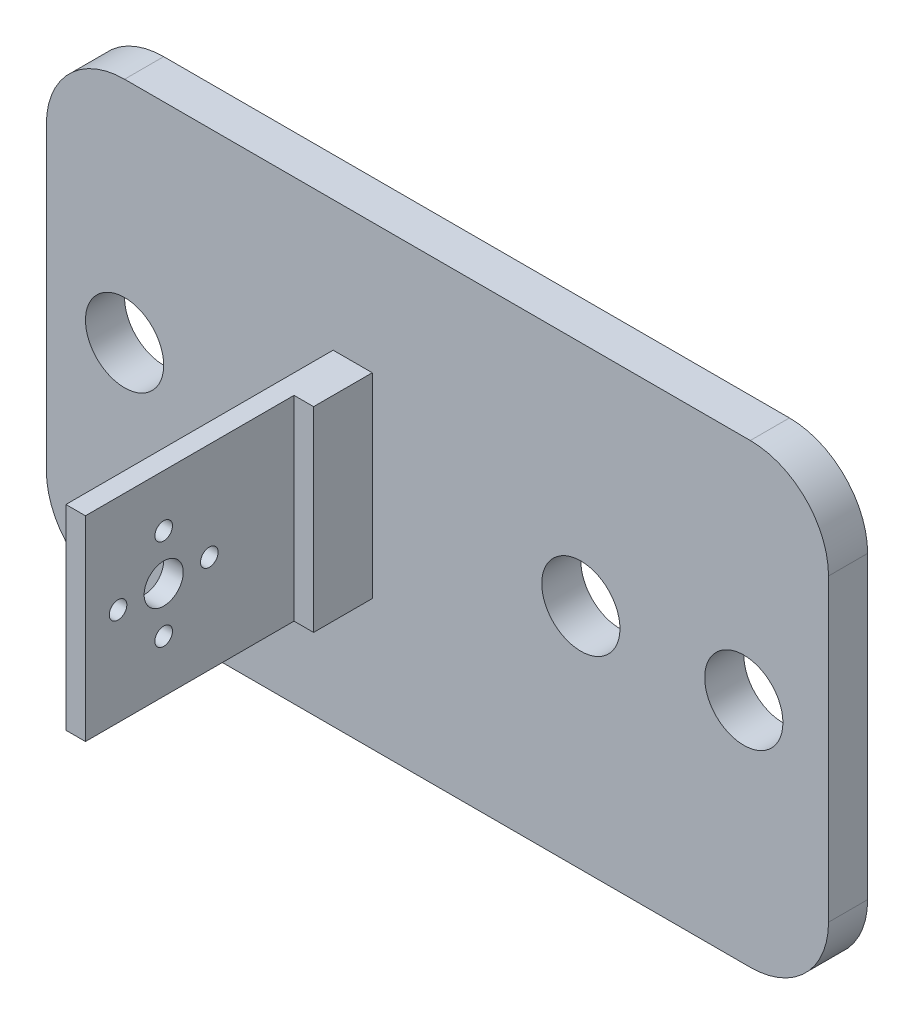
from build123d import *

# Parameters (mm, degrees)
S_BOX1_W      = 120
S_BOX1_H      = 70
BOSS_1_DEPTH  = 6
S_BOX2_W      = 3
S_BOX2_H      = 30
BOSS_2_DEPTH  = 41.5
S_BOX3_W      = 3.5
S_BOX3_H      = 30
BOSS_3_DEPTH  = 9.5
S_HOLE4_R     = 3
HOLE_4_DEPTH  = 3.2
S_HOLE5_R     = 1.35
HOLE_5_DEPTH  = 3.2
S_HOLE6_R     = 1.35
HOLE_6_DEPTH  = 3.2
S_HOLE7_R     = 1.35
HOLE_7_DEPTH  = 3.2
S_HOLE8_R     = 1.35
HOLE_8_DEPTH  = 3.2
S_HOLE9_R     = 6
HOLE_9_DEPTH  = 6.2
S_HOLE10_R    = 6
HOLE_10_DEPTH = 6.2
S_HOLE11_R    = 6
HOLE_11_DEPTH = 6.2
S_HOLE12_R    = 6
HOLE_12_DEPTH = 6.2
CUT_13_DEPTH  = 6.2
CUT_14_DEPTH  = 6.2
CUT_15_DEPTH  = 6.2
CUT_16_DEPTH  = 6.2


with BuildPart() as part:
    # S_box1 → Boss_1 (new body)
    with BuildSketch(Plane.XY.offset(-35)):
        with Locations((-2, 0)):
            Rectangle(S_BOX1_W, S_BOX1_H)
    extrude(amount=BOSS_1_DEPTH)

    # S_box2 → Boss_2 (add)
    with BuildSketch(Plane.XY.offset(-29.5)):
        with Locations((-16.5, 0)):
            Rectangle(S_BOX2_W, S_BOX2_H)
    extrude(amount=BOSS_2_DEPTH)

    # S_box3 → Boss_3 (add)
    with BuildSketch(Plane.XY.offset(-29.5)):
        with Locations((-13.75, 0)):
            Rectangle(S_BOX3_W, S_BOX3_H)
    extrude(amount=BOSS_3_DEPTH)

    # S_hole4 → Hole_4 (cut)
    with BuildSketch(Plane(origin=(-18.1, 0, 0), x_dir=(0, 0, -1), z_dir=(1, 0, 0))):
        Circle(S_HOLE4_R)
    extrude(amount=HOLE_4_DEPTH, mode=Mode.SUBTRACT)

    # S_hole5 → Hole_5 (cut)
    with BuildSketch(Plane(origin=(-18.1, 0, 0), x_dir=(0, 0, -1), z_dir=(1, 0, 0))):
        with Locations((0, 7)):
            Circle(S_HOLE5_R)
    extrude(amount=HOLE_5_DEPTH, mode=Mode.SUBTRACT)

    # S_hole6 → Hole_6 (cut)
    with BuildSketch(Plane(origin=(-18.1, 0, 0), x_dir=(0, 0, -1), z_dir=(1, 0, 0))):
        with Locations((-7, 0)):
            Circle(S_HOLE6_R)
    extrude(amount=HOLE_6_DEPTH, mode=Mode.SUBTRACT)

    # S_hole7 → Hole_7 (cut)
    with BuildSketch(Plane(origin=(-18.1, 0, 0), x_dir=(0, 0, -1), z_dir=(1, 0, 0))):
        with Locations((0, -7)):
            Circle(S_HOLE7_R)
    extrude(amount=HOLE_7_DEPTH, mode=Mode.SUBTRACT)

    # S_hole8 → Hole_8 (cut)
    with BuildSketch(Plane(origin=(-18.1, 0, 0), x_dir=(0, 0, -1), z_dir=(1, 0, 0))):
        with Locations((7, 0)):
            Circle(S_HOLE8_R)
    extrude(amount=HOLE_8_DEPTH, mode=Mode.SUBTRACT)

    # S_hole9 → Hole_9 (cut)
    with BuildSketch(Plane.XY.offset(-35.1)):
        with Locations((-50, 0)):
            Circle(S_HOLE9_R)
    extrude(amount=HOLE_9_DEPTH, mode=Mode.SUBTRACT)

    # S_hole10 → Hole_10 (cut)
    with BuildSketch(Plane.XY.offset(-35.1)):
        with Locations((-20, 0)):
            Circle(S_HOLE10_R)
    extrude(amount=HOLE_10_DEPTH, mode=Mode.SUBTRACT)

    # S_hole11 → Hole_11 (cut)
    with BuildSketch(Plane.XY.offset(-35.1)):
        with Locations((20, 0)):
            Circle(S_HOLE11_R)
    extrude(amount=HOLE_11_DEPTH, mode=Mode.SUBTRACT)

    # S_hole12 → Hole_12 (cut)
    with BuildSketch(Plane.XY.offset(-35.1)):
        with Locations((45, 0)):
            Circle(S_HOLE12_R)
    extrude(amount=HOLE_12_DEPTH, mode=Mode.SUBTRACT)

    # S_pcut13 → Cut_13 (cut)
    with BuildSketch(Plane.XY.offset(-35.1)):
        with BuildLine():
            Line((58.6, 35.6), (46, 35.6))
            Line((46, 35.6), (46, 35))
            ThreePointArc((46, 35), (54.4853, 31.4853), (58, 23))
            Line((58, 23), (58.6, 23))
            Line((58.6, 23), (58.6, 35.6))
        make_face()
    extrude(amount=CUT_13_DEPTH, mode=Mode.SUBTRACT)

    # S_pcut14 → Cut_14 (cut)
    with BuildSketch(Plane.XY.offset(-35.1)):
        with BuildLine():
            Line((58.6, -35.6), (46, -35.6))
            Line((46, -35.6), (46, -35))
            ThreePointArc((46, -35), (54.4853, -31.4853), (58, -23))
            Line((58, -23), (58.6, -23))
            Line((58.6, -23), (58.6, -35.6))
        make_face()
    extrude(amount=CUT_14_DEPTH, mode=Mode.SUBTRACT)

    # S_pcut15 → Cut_15 (cut)
    with BuildSketch(Plane.XY.offset(-35.1)):
        with BuildLine():
            Line((-62.6, 35.6), (-50, 35.6))
            Line((-50, 35.6), (-50, 35))
            ThreePointArc((-50, 35), (-58.4853, 31.4853), (-62, 23))
            Line((-62, 23), (-62.6, 23))
            Line((-62.6, 23), (-62.6, 35.6))
        make_face()
    extrude(amount=CUT_15_DEPTH, mode=Mode.SUBTRACT)

    # S_pcut16 → Cut_16 (cut)
    with BuildSketch(Plane.XY.offset(-35.1)):
        with BuildLine():
            Line((-62.6, -35.6), (-50, -35.6))
            Line((-50, -35.6), (-50, -35))
            ThreePointArc((-50, -35), (-58.4853, -31.4853), (-62, -23))
            Line((-62, -23), (-62.6, -23))
            Line((-62.6, -23), (-62.6, -35.6))
        make_face()
    extrude(amount=CUT_16_DEPTH, mode=Mode.SUBTRACT)


solid = part.part
